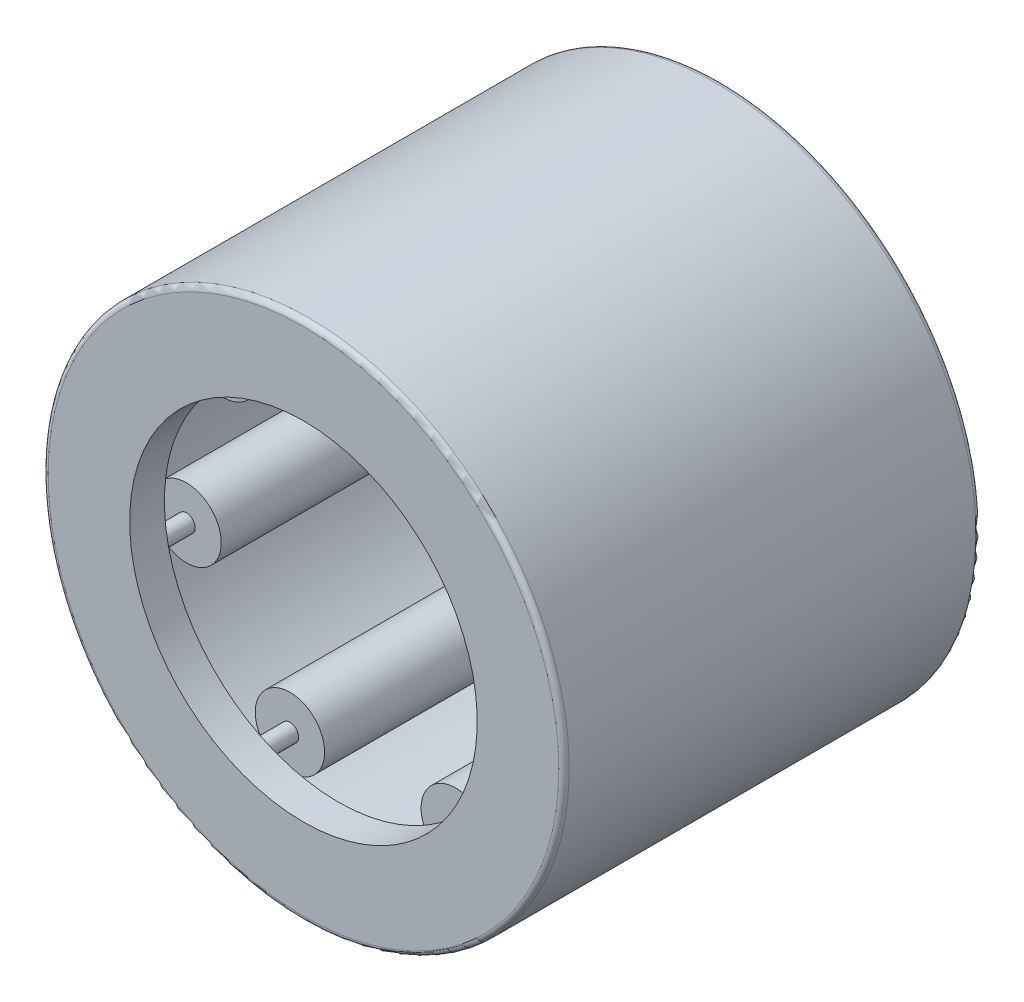
from build123d import *

# Parameters (mm, degrees)
SKETCH2_W         = 5.338
SKETCH2_H         = 0.499125
SKETCH3_W         = 6.669
SKETCH3_H         = 0.166375
CIRPATTERN1_COUNT = 7
CIRPATTERN1_ANGLE = 308.571428571
FILLET1_R         = 0.09993


with BuildPart() as part:
    # Sketch1 → Revolve1 (revolve)
    with BuildSketch(Plane(origin=(0, 0, 0), x_dir=(0, 0, -1), z_dir=(1, 0, 0))):
        Polygon((-4, 4.9965), (4, 4.9965), (4, 3.33275), (3.3345, 3.33275), (3.3345, 4.331), (-3.3345, 4.331), (-3.3345, 3.33275), (-4, 3.33275), align=None)
    revolve(axis=Axis((0, 0, 4), (0, 0, -1)))

    # Fillet1
    fillet1_edges = [part.edges().sort_by_distance(p)[0] for p in [
        (0, -4.9965, -4),
        (0, -4.9965, 4),
    ]]
    fillet(fillet1_edges, radius=FILLET1_R)


with BuildPart() as body_2:
    # Sketch2 → Revolve2 (revolve)
    with BuildSketch(Plane(origin=(0, 0, 0), x_dir=(0, 0, -1), z_dir=(1, 0, 0))):
        with Locations((0, 4.0814375)):
            Rectangle(SKETCH2_W, SKETCH2_H)
    revolve(axis=Axis((0, 3.6655, 2.669), (0, 0, -1)))


with BuildPart() as body_3:
    # Sketch3 → Revolve3 (revolve)
    with BuildSketch(Plane(origin=(0, 0, 0), x_dir=(0, 0, -1), z_dir=(1, 0, 0))):
        with Locations((0, 3.7486875)):
            Rectangle(SKETCH3_W, SKETCH3_H)
    revolve(axis=Axis((0, 3.6655, 3.3345), (0, 0, -1)))


with BuildPart() as cirpattern1_1:
    # CirPattern1: pattern copy
    add(body_3.part.rotate(Axis((0, 0, -4), (0, 0, 1)), 1 * CIRPATTERN1_ANGLE / (CIRPATTERN1_COUNT - 1)))


with BuildPart() as cirpattern1_2:
    # CirPattern1: pattern copy
    add(body_3.part.rotate(Axis((0, 0, -4), (0, 0, 1)), 2 * CIRPATTERN1_ANGLE / (CIRPATTERN1_COUNT - 1)))


with BuildPart() as cirpattern1_3:
    # CirPattern1: pattern copy
    add(body_3.part.rotate(Axis((0, 0, -4), (0, 0, 1)), 3 * CIRPATTERN1_ANGLE / (CIRPATTERN1_COUNT - 1)))


with BuildPart() as cirpattern1_4:
    # CirPattern1: pattern copy
    add(body_3.part.rotate(Axis((0, 0, -4), (0, 0, 1)), 4 * CIRPATTERN1_ANGLE / (CIRPATTERN1_COUNT - 1)))


with BuildPart() as cirpattern1_5:
    # CirPattern1: pattern copy
    add(body_3.part.rotate(Axis((0, 0, -4), (0, 0, 1)), 5 * CIRPATTERN1_ANGLE / (CIRPATTERN1_COUNT - 1)))


with BuildPart() as cirpattern1_6:
    # CirPattern1: pattern copy
    add(body_3.part.rotate(Axis((0, 0, -4), (0, 0, 1)), 6 * CIRPATTERN1_ANGLE / (CIRPATTERN1_COUNT - 1)))


with BuildPart() as cirpattern1_7:
    # CirPattern1: pattern copy
    add(body_2.part.rotate(Axis((0, 0, -4), (0, 0, 1)), 1 * CIRPATTERN1_ANGLE / (CIRPATTERN1_COUNT - 1)))


with BuildPart() as cirpattern1_8:
    # CirPattern1: pattern copy
    add(body_2.part.rotate(Axis((0, 0, -4), (0, 0, 1)), 2 * CIRPATTERN1_ANGLE / (CIRPATTERN1_COUNT - 1)))


with BuildPart() as cirpattern1_9:
    # CirPattern1: pattern copy
    add(body_2.part.rotate(Axis((0, 0, -4), (0, 0, 1)), 3 * CIRPATTERN1_ANGLE / (CIRPATTERN1_COUNT - 1)))


with BuildPart() as cirpattern1_10:
    # CirPattern1: pattern copy
    add(body_2.part.rotate(Axis((0, 0, -4), (0, 0, 1)), 4 * CIRPATTERN1_ANGLE / (CIRPATTERN1_COUNT - 1)))


with BuildPart() as cirpattern1_11:
    # CirPattern1: pattern copy
    add(body_2.part.rotate(Axis((0, 0, -4), (0, 0, 1)), 5 * CIRPATTERN1_ANGLE / (CIRPATTERN1_COUNT - 1)))


with BuildPart() as cirpattern1_12:
    # CirPattern1: pattern copy
    add(body_2.part.rotate(Axis((0, 0, -4), (0, 0, 1)), 6 * CIRPATTERN1_ANGLE / (CIRPATTERN1_COUNT - 1)))


solid = Compound([part.part, body_2.part, body_3.part, cirpattern1_1.part, cirpattern1_2.part, cirpattern1_3.part, cirpattern1_4.part, cirpattern1_5.part, cirpattern1_6.part, cirpattern1_7.part, cirpattern1_8.part, cirpattern1_9.part, cirpattern1_10.part, cirpattern1_11.part, cirpattern1_12.part])
